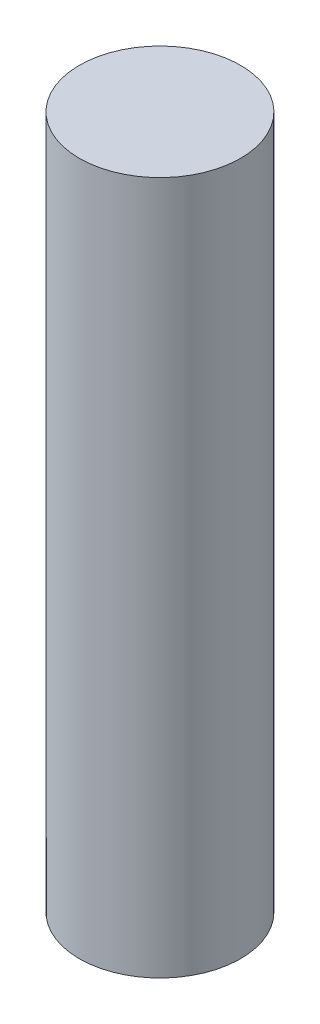
from build123d import *

# Parameters (mm, degrees)
SKETCH1_R           = 10
BOSS_EXTRUDE1_DEPTH = 86


with BuildPart() as part:
    # Sketch1 → Boss-Extrude1 (new body)
    with BuildSketch(Plane(origin=(0, 0, 0), x_dir=(1, 0, 0), z_dir=(0, 1, 0))):
        Circle(SKETCH1_R)
    extrude(amount=BOSS_EXTRUDE1_DEPTH)


solid = part.part
